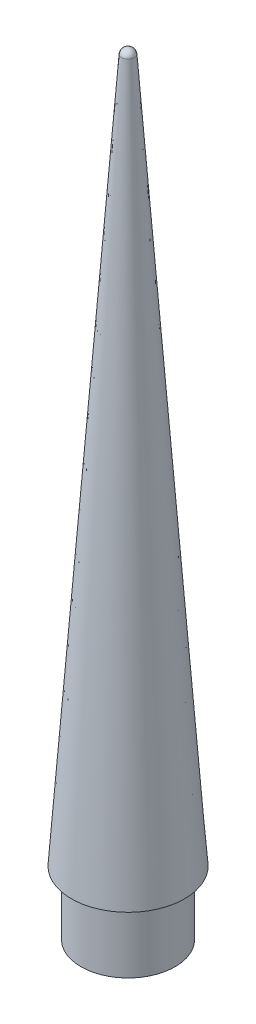
from build123d import *

# Parameters (mm, degrees)
SKETCH1_R                     = 9.398
BOSS_EXTRUDE1_DEPTH           = 12.7
TAP_DRILL_FOR_8_32_TAP1_D     = 3.4544
TAP_DRILL_FOR_8_32_TAP1_DEPTH = 10.16
TAP_DRILL_FOR_8_32_TAP1_TIP   = 1.037806461


with BuildPart() as part:
    # Sketch1 → Boss-Extrude1 (new body)
    with BuildSketch(Plane(origin=(0, 0, 0), x_dir=(1, 0, 0), z_dir=(0, 1, 0))):
        Circle(SKETCH1_R)
    extrude(amount=BOSS_EXTRUDE1_DEPTH)

    # Sketch3 → Revolve1 (revolve)
    with BuildSketch(Plane(origin=(0, 0, 0), x_dir=(0, 0, -1), z_dir=(1, 0, 0))):
        with BuildLine():
            Line((0, 12.7), (11.303, 12.7))
            Line((11.303, 12.7), (1.25705845, 153.079969258))
            ThreePointArc((1.25705845, 153.079969258), (0.831633895, 153.858962594), (0, 154.169126638))
            Line((0, 154.169126638), (0, 12.7))
        make_face()
    revolve(axis=Axis((0, 170.645851528, 0), (0, -1, 0)))

    # Tap Drill for #8-32 Tap1
    with Locations(Plane(origin=(0, 0, 0), x_dir=(-1, 0, 0), z_dir=(0, -1, 0))):
        with Locations((0, 0)):
            Hole(TAP_DRILL_FOR_8_32_TAP1_D / 2, depth=TAP_DRILL_FOR_8_32_TAP1_DEPTH)
            with Locations((0, 0, -(TAP_DRILL_FOR_8_32_TAP1_DEPTH + TAP_DRILL_FOR_8_32_TAP1_TIP / 2))):  # 118° drill point
                Cone(0, TAP_DRILL_FOR_8_32_TAP1_D / 2, TAP_DRILL_FOR_8_32_TAP1_TIP, mode=Mode.SUBTRACT)


solid = part.part
